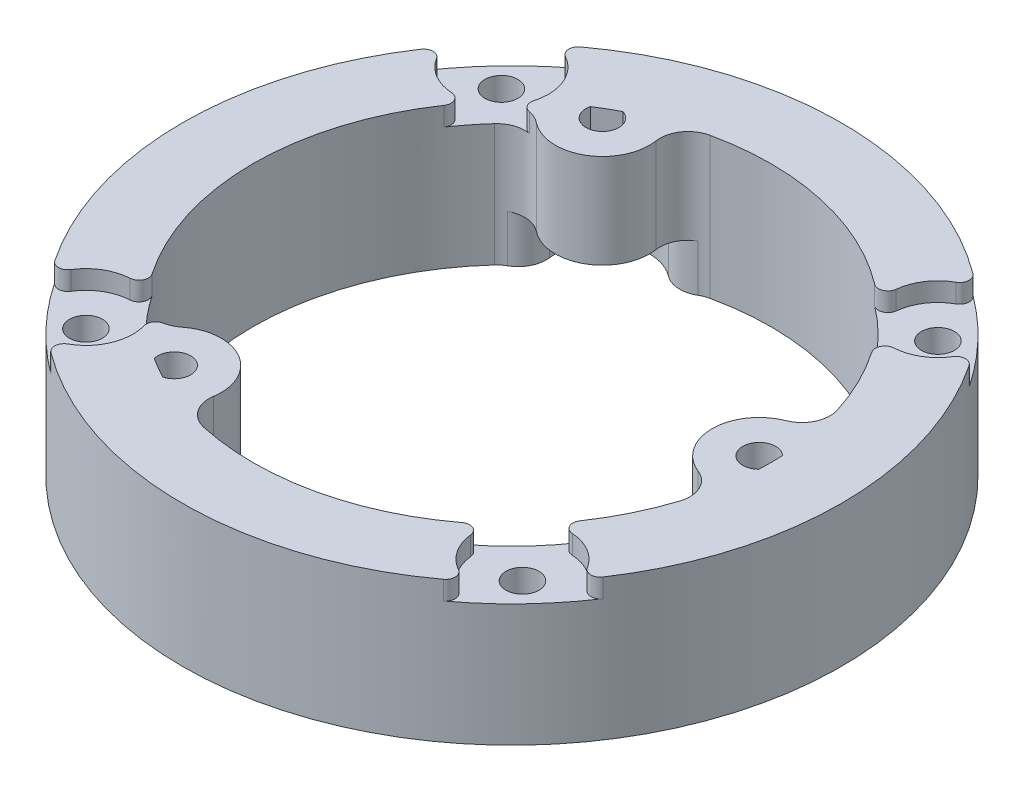
from build123d import *

# Parameters (mm, degrees)
SKETCH_1_R          = 35
SKETCH_1_R_2        = 1.75
SKETCH_1_R_3        = 27.5
EXTRUDE_1_DEPTH     = 15
SKETCH_2_R          = 5
SKETCH_2_R_2        = 1.75
EXTRUDE_2_DEPTH     = 15
FILLET_1_R          = 3
SKETCH_3_R          = 5
CUT_EXTRUDE_1_DEPTH = 2
CUT_EXTRUDE_START   = -5
SKETCH_4_R          = 5
CUT_EXTRUDE_2_DEPTH = 5
FILLET_2_DEPTH      = 5
FILLET_3_R          = 1


with BuildPart() as part:
    # Эскиз1 → Бобышка-Вытянуть1 (new body)
    with BuildSketch(Plane(origin=(0, 0, 0), x_dir=(1, 0, 0), z_dir=(0, 1, 0))):
        with Locations(Location((0, 0, 0), (0, 0, 270))):
            Circle(SKETCH_1_R)
        with Locations(Location((-23.18, 22.0605, 0), (0, 0, 270))):
            Circle(SKETCH_1_R_2, mode=Mode.SUBTRACT)
        with Locations(Location((23.18, 22.0605, 0), (0, 0, 270))):
            Circle(SKETCH_1_R_2, mode=Mode.SUBTRACT)
        with Locations(Location((23.18, -22.0605, 0), (0, 0, 270))):
            Circle(SKETCH_1_R_2, mode=Mode.SUBTRACT)
        with Locations(Location((-23.18, -22.0605, 0), (0, 0, 270))):
            Circle(SKETCH_1_R_2, mode=Mode.SUBTRACT)
        with Locations(Location((0, 0, 0), (0, 0, 270))):
            Circle(SKETCH_1_R_3, mode=Mode.SUBTRACT)
    extrude(amount=EXTRUDE_1_DEPTH)

    # Эскиз2 → Бобышка-Вытянуть2 (add)
    # profile 1 of 3: a face of its own
    with BuildSketch(Plane(origin=(0, 15, 0), x_dir=(1, 0, 0), z_dir=(0, 1, 0))):
        with Locations((-13.13, 22.741827103)):
            Circle(SKETCH_2_R)
        with Locations((-13.13, 22.741827103)):
            Circle(SKETCH_2_R_2, mode=Mode.SUBTRACT)
    # profile 2 of 3: a face of its own
    with BuildSketch(Plane(origin=(0, 15, 0), x_dir=(1, 0, 0), z_dir=(0, 1, 0))):
        with Locations((26.26, 0)):
            Circle(SKETCH_2_R)
        with Locations((26.26, 0)):
            Circle(SKETCH_2_R_2, mode=Mode.SUBTRACT)
    # profile 3 of 3: a face of its own
    with BuildSketch(Plane(origin=(0, 15, 0), x_dir=(1, 0, 0), z_dir=(0, 1, 0))):
        with Locations((-13.13, -22.741827103)):
            Circle(SKETCH_2_R)
        with Locations((-13.13, -22.741827103)):
            Circle(SKETCH_2_R_2, mode=Mode.SUBTRACT)
    extrude(amount=-EXTRUDE_2_DEPTH)

    # Скругление1
    fillet_1_edges = [part.edges().sort_by_distance(p)[0] for p in [
        (27.053267327, 7.5, -4.936671647),
        (27.053267327, 7.5, 4.936671647),
        (-17.80191672, 7.5, -20.960480937),
        (-9.251350607, 7.5, -25.897152584),
        (-9.251350607, 7.5, 25.897152584),
        (-17.80191672, 7.5, 20.960480937),
    ]]
    fillet(fillet_1_edges, radius=FILLET_1_R)

    # Эскиз3 → Вырез-Вытянуть1 (cut)
    with BuildSketch(Plane(origin=(0, 15, 0), x_dir=(1, 0, 0), z_dir=(0, 1, 0))):
        with Locations((-23.18, 22.0605)):
            Circle(SKETCH_3_R)
        with Locations((23.18, 22.0605)):
            Circle(SKETCH_3_R)
        with Locations((23.18, -22.0605)):
            Circle(SKETCH_3_R)
        with Locations((-23.18, -22.0605)):
            Circle(SKETCH_3_R)
    extrude(amount=-CUT_EXTRUDE_1_DEPTH, mode=Mode.SUBTRACT)

    # Эскиз4 → Вырез-Вытянуть2 (cut)
    with BuildSketch(Plane.XZ.offset(CUT_EXTRUDE_START)):
        with Locations((-13.13, 22.741827103)):
            Circle(SKETCH_4_R)
        with Locations((26.26, 0)):
            Circle(SKETCH_4_R)
        with Locations((-13.13, -22.741827103)):
            Circle(SKETCH_4_R)
    extrude(amount=CUT_EXTRUDE_2_DEPTH, mode=Mode.SUBTRACT)

    # Скругление2: read off the stored shape, not the designer's step
    # Скругление2 outline → Скругление2 (cut)
    with BuildSketch(Plane(origin=(0, 0, 0), x_dir=(1, 0, 0), z_dir=(0, 1, 0))):
        with BuildLine():
            ThreePointArc((-16.249088608, 18.83397779), (-17.48691602, 20.288812061), (-18.08884989, 22.101664805))
            ThreePointArc((-18.08884989, 22.101664805), (-18.38244619, 20.372795331), (-19.592350799, 19.103417814))
            ThreePointArc((-19.592350799, 19.103417814), (-17.87954729, 19.479572812), (-16.249088608, 18.83397779))
        make_face()
        with BuildLine():
            ThreePointArc((-6.747869727, 26.519182418), (-8.452135208, 26.10606305), (-10.096178242, 26.716235932))
            ThreePointArc((-10.096178242, 26.716235932), (-8.827168648, 25.288519537), (-8.186158917, 23.489112418))
            ThreePointArc((-8.186158917, 23.489112418), (-7.930031265, 25.223928567), (-6.747869727, 26.519182418))
        make_face()
        with BuildLine():
            ThreePointArc((24.435247525, 4.655134628), (26.314084667, 4.999707476), (28.185028132, 4.614571128))
            ThreePointArc((28.185028132, 4.614571128), (26.834581398, 5.733267719), (26.340220525, 7.415764604))
            ThreePointArc((26.340220525, 7.415764604), (25.809578555, 5.744355755), (24.435247525, 4.655134628))
        make_face()
        with BuildLine():
            ThreePointArc((26.340220525, -7.415764604), (26.834581398, -5.733267719), (28.185028132, -4.614571128))
            ThreePointArc((28.185028132, -4.614571128), (26.314084667, -4.999707476), (24.435247525, -4.655134628))
            ThreePointArc((24.435247525, -4.655134628), (25.809578555, -5.744355755), (26.340220525, -7.415764604))
        make_face()
        with BuildLine():
            ThreePointArc((-8.186158917, -23.489112418), (-8.827168648, -25.288519537), (-10.096178242, -26.716235932))
            ThreePointArc((-10.096178242, -26.716235932), (-8.452135208, -26.10606305), (-6.747869727, -26.519182418))
            ThreePointArc((-6.747869727, -26.519182418), (-7.930031265, -25.223928567), (-8.186158917, -23.489112418))
        make_face()
        with BuildLine():
            ThreePointArc((-19.592350799, -19.103417814), (-18.38244619, -20.372795331), (-18.08884989, -22.101664805))
            ThreePointArc((-18.08884989, -22.101664805), (-17.48691602, -20.288812061), (-16.249088608, -18.83397779))
            ThreePointArc((-16.249088608, -18.83397779), (-17.87954729, -19.479572812), (-19.592350799, -19.103417814))
        make_face()
    extrude(amount=FILLET_2_DEPTH, mode=Mode.SUBTRACT)

    # Скругление3
    fillet_3_edges = [part.edges().sort_by_distance(p)[0] for p in [
        (-18.967333591, 14, -19.36727856),
        (-18.967333591, 14, 19.36727856),
        (21.259108635, 14, 17.444205342),
        (18.474346617, 14, 20.370285149),
        (22.293687033, 14, -26.981317953),
        (28.050957484, 14, -20.931884393),
        (-21.259108635, 14, 17.444205342),
        (-28.050957484, 14, 20.931884393),
        (-22.293687033, 14, 26.981317953),
        (22.293687033, 14, 26.981317953),
        (28.050957484, 14, 20.931884393),
        (21.259108635, 14, -17.444205342),
        (18.474346617, 14, -20.370285149),
        (-21.259108635, 14, -17.444205342),
        (-22.293687033, 14, -26.981317953),
        (-28.050957484, 14, -20.931884393),
    ]]
    fillet(fillet_3_edges, radius=FILLET_3_R)


solid = part.part
